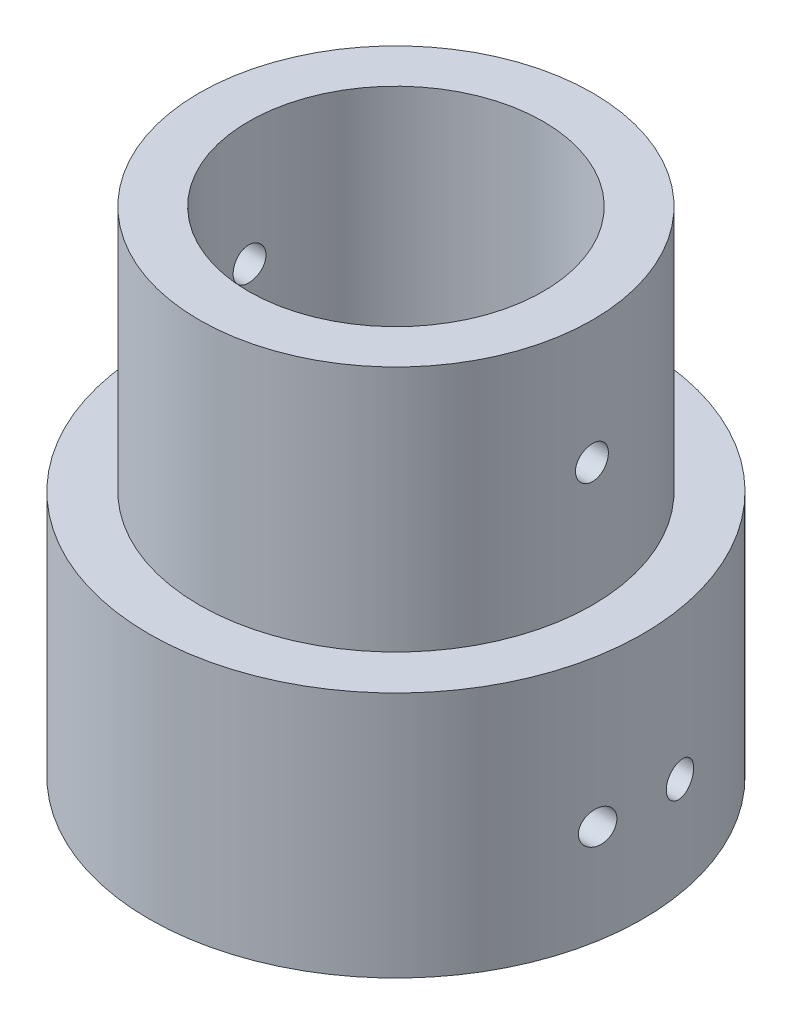
from build123d import *

# Parameters (mm, degrees)
SKETCH1_R                = 15
BOSS_EXTRUDE1_DEPTH      = 15
BOSS_EXTRUDE2_DEPTH      = 15
BOSS_EXTRUDE2_DEPTH_BACK = 3
SKETCH2_R                = 11.95
SKETCH2_R_2              = 8.95
CUT_EXTRUDE1_DEPTH       = 37.742346142
CUT_EXTRUDE1_DEPTH_BACK  = 37.742346142
SKETCH3_R                = 1
SKETCH4_R                = 11
BOSS_EXTRUDE3_DEPTH      = 5
M3_CLEARANCE_HOLE1_D     = 3.4
SKETCH8_R                = 26.295997506
CUT_EXTRUDE2_DEPTH       = 72.239034265
SKETCH9_W                = 6.2
SKETCH9_H                = 15.5
CUT_EXTRUDE3_DEPTH       = 12


with BuildPart() as part:
    # Sketch1 → Boss-Extrude1 (new body)
    with BuildSketch(Plane(origin=(0, 0, 0), x_dir=(1, 0, 0), z_dir=(0, 1, 0))):
        Circle(SKETCH1_R)
    extrude(amount=BOSS_EXTRUDE1_DEPTH)

    # Sketch2 → Boss-Extrude2 (add, two sides: drawn at the far end of the back side and taken through both)
    with BuildSketch(Plane(origin=(0, 15, 0), x_dir=(1, 0, 0), z_dir=(0, 1, 0)).offset(-BOSS_EXTRUDE2_DEPTH_BACK)):
        Circle(SKETCH2_R)
        Circle(SKETCH2_R_2, mode=Mode.SUBTRACT)
    extrude(amount=BOSS_EXTRUDE2_DEPTH + BOSS_EXTRUDE2_DEPTH_BACK)

    # Sketch3 → Cut-Extrude1 (cut, two sides: drawn at the far end of the back side and taken through both)
    with BuildSketch(Plane(origin=(0, 0, 0), x_dir=(0, 0, -1), z_dir=(1, 0, 0)).offset(-CUT_EXTRUDE1_DEPTH_BACK)):
        with Locations((0, 22.5)):
            Circle(SKETCH3_R)
        with Locations((-2.5, 6)):
            Circle(SKETCH3_R)
        with Locations((2.5, 6)):
            Circle(SKETCH3_R)
    extrude(amount=CUT_EXTRUDE1_DEPTH + CUT_EXTRUDE1_DEPTH_BACK, mode=Mode.SUBTRACT)

    # Sketch4 → Boss-Extrude3 (add)
    with BuildSketch(Plane(origin=(0, 0, 0), x_dir=(0, 0, -1), z_dir=(1, 0, 0))):
        with BuildLine():
            Line((11, 0), (-11, 0))
            Line((-11, 0), (-11, -12))
            ThreePointArc((-11, -12), (-12.05572809, -16.472135955), (-15, -20))
            ThreePointArc((-15, -20), (0, -65), (15, -20))
            ThreePointArc((15, -20), (12.05572809, -16.472135955), (11, -12))
            Line((11, -12), (11, 0))
        make_face()
        with Locations((0, -40)):
            Circle(SKETCH4_R, mode=Mode.SUBTRACT)
    extrude(amount=BOSS_EXTRUDE3_DEPTH)

    # M3 Clearance Hole1 (through all)
    with Locations(Plane(origin=(5, 0, 0), x_dir=(0, 0, -1), z_dir=(1, 0, 0))):
        with Locations((10.606601718, -50.606601718), (-10.606601718, -50.606601718), (-10.606601718, -29.393398282), (10.606601718, -29.393398282)):
            Hole(M3_CLEARANCE_HOLE1_D / 2)

    # Sketch8 → Cut-Extrude2 (cut, through all)
    with BuildSketch(Plane.XZ):
        Circle(SKETCH8_R)
    extrude(amount=CUT_EXTRUDE2_DEPTH, mode=Mode.SUBTRACT)

    # Sketch9 → Cut-Extrude3 (cut)
    with BuildSketch(Plane.XZ):
        with Locations((3.1, 0)):
            Rectangle(SKETCH9_W, SKETCH9_H)
    extrude(amount=-CUT_EXTRUDE3_DEPTH, mode=Mode.SUBTRACT)


solid = part.part
